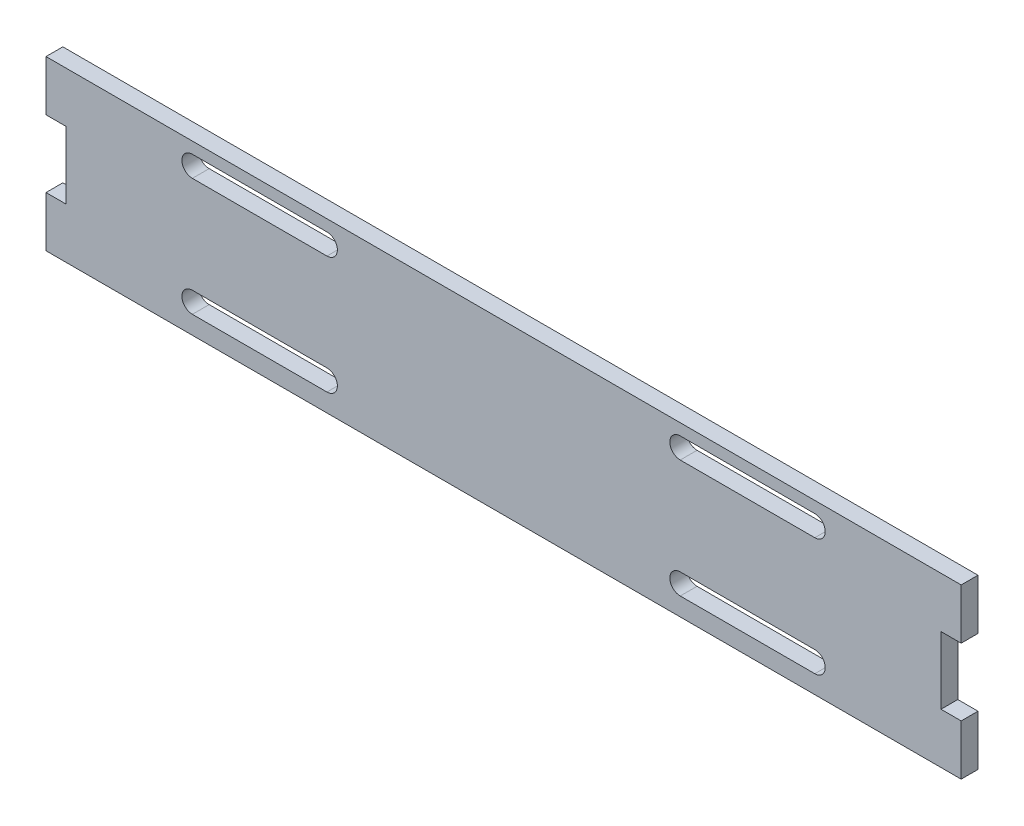
from build123d import *

# Parameters (mm, degrees)
EXTRUDE_1_DEPTH     = 5
CUT_EXTRUDE_1_DEPTH = 139.369071689


with BuildPart() as part:
    # 草圖1 → 填料-伸長1 (new body)
    with BuildSketch(Plane.XY):
        Polygon((136, -25), (136, -10), (130, -10), (130, 10), (136, 10), (136, 25), (-136, 25), (-136, 10), (-130, 10), (-130, -10), (-136, -10), (-136, -25), align=None)
    extrude(amount=EXTRUDE_1_DEPTH)

    # 草圖2 → 除料-伸長1 (cut, through all)
    with BuildSketch(Plane.XY.offset(5)):
        with BuildLine():
            Line((-92.5, 21.6), (-52.5, 21.6))
            ThreePointArc((-52.5, 21.6), (-49.4, 18.5), (-52.5, 15.4))
            Line((-52.5, 15.4), (-92.5, 15.4))
            ThreePointArc((-92.5, 15.4), (-95.6, 18.5), (-92.5, 21.6))
        make_face()
        with BuildLine():
            Line((-92.5, -13.4), (-52.5, -13.4))
            ThreePointArc((-52.5, -13.4), (-49.4, -16.5), (-52.5, -19.6))
            Line((-52.5, -19.6), (-92.5, -19.6))
            ThreePointArc((-92.5, -19.6), (-95.6, -16.5), (-92.5, -13.4))
        make_face()
        with BuildLine():
            Line((52.5, 21.6), (92.5, 21.6))
            ThreePointArc((92.5, 21.6), (95.6, 18.5), (92.5, 15.4))
            Line((92.5, 15.4), (52.5, 15.4))
            ThreePointArc((52.5, 15.4), (49.4, 18.5), (52.5, 21.6))
        make_face()
        with BuildLine():
            Line((52.5, -13.4), (92.5, -13.4))
            ThreePointArc((92.5, -13.4), (95.6, -16.5), (92.5, -19.6))
            Line((92.5, -19.6), (52.5, -19.6))
            ThreePointArc((52.5, -19.6), (49.4, -16.5), (52.5, -13.4))
        make_face()
    extrude(amount=-CUT_EXTRUDE_1_DEPTH, mode=Mode.SUBTRACT)


solid = part.part
